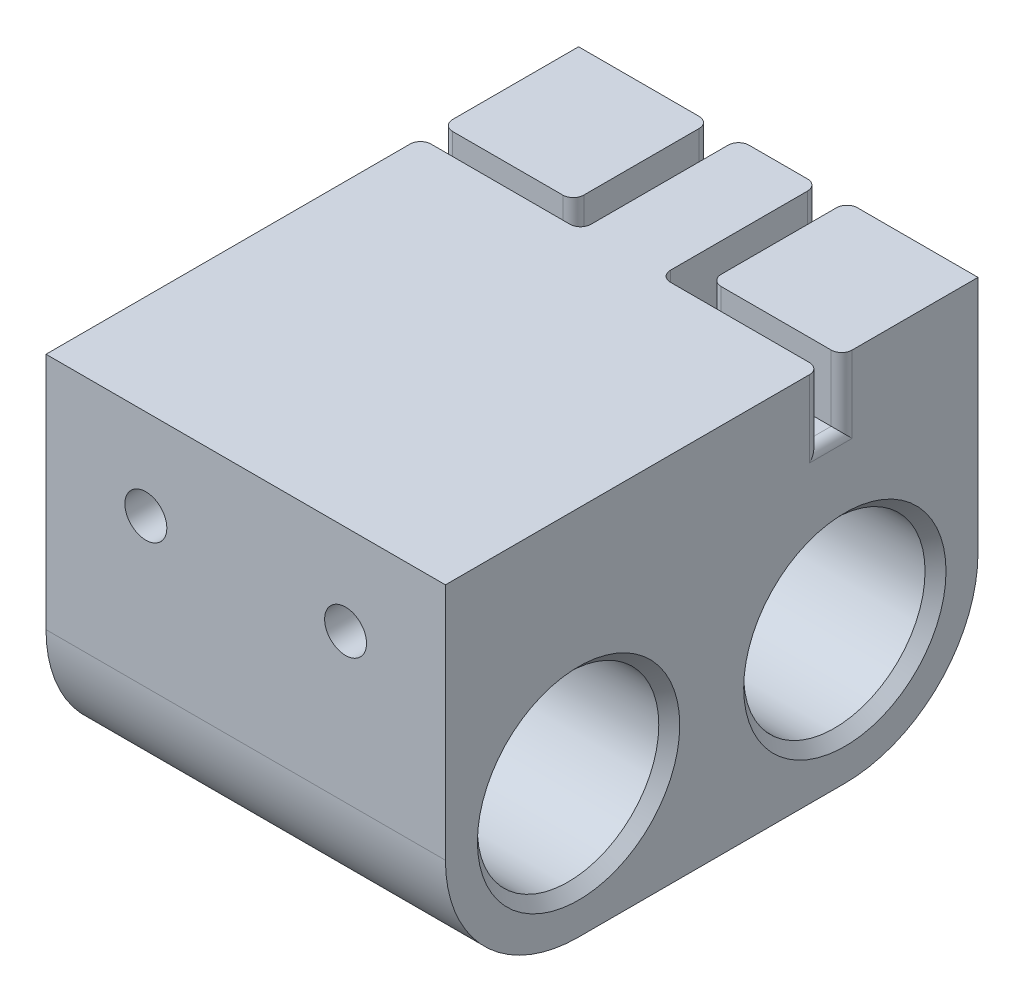
from build123d import *

# Parameters (mm, degrees)
SKETCH1_R           = 8.65
BOSS_EXTRUDE2_DEPTH = 38.1
CUT_EXTRUDE5_REACH  = 74.725
SKETCH6_R           = 2
BOSS_EXTRUDE3_REACH = 74.725
SKETCH10_R          = 2
CUT_EXTRUDE6_DEPTH  = 8
CHAMFER1_SIZE       = 1
CUT_EXTRUDE9_DEPTH  = 6.3
FILLET3_R           = 1


with BuildPart() as part:
    # Sketch1 → Boss-Extrude2 (new body)
    with BuildSketch(Plane(origin=(0, 0, 0), x_dir=(0, 0, -1), z_dir=(1, 0, 0))):
        with BuildLine():
            Line((50.8, 22.75), (0, 22.75))
            Line((0, 22.75), (0, 0))
            ThreePointArc((0, 0), (12.7, -12.7), (25.4, 0))
            ThreePointArc((25.4, 0), (38.1, -12.7), (50.8, 0))
            Line((50.8, 0), (50.8, 22.75))
        make_face()
        with Locations((38.1, 0)):
            Circle(SKETCH1_R, mode=Mode.SUBTRACT)
        with Locations((12.7, 0)):
            Circle(SKETCH1_R, mode=Mode.SUBTRACT)
    extrude(amount=BOSS_EXTRUDE2_DEPTH)

    # Sketch6 → Cut-Extrude5 (cut, up to next)
    with BuildSketch(Plane(origin=(0, -12.7, 0), x_dir=(-1, 0, 0), z_dir=(0, -1, 0)), mode=Mode.PRIVATE) as cut_extrude5_sk1:
        with Locations((-19.05, 38.1)):
            Circle(SKETCH6_R)
    cut_extrude5_tool1 = extrude(cut_extrude5_sk1.sketch, amount=-CUT_EXTRUDE5_REACH, mode=Mode.PRIVATE) & part.part
    # Sketch6 → Cut-Extrude5 (cut, up to next)
    with BuildSketch(Plane(origin=(0, -12.7, 0), x_dir=(-1, 0, 0), z_dir=(0, -1, 0)), mode=Mode.PRIVATE) as cut_extrude5_sk2:
        with Locations((-19.05, 12.7)):
            Circle(SKETCH6_R)
    cut_extrude5_tool2 = extrude(cut_extrude5_sk2.sketch, amount=-CUT_EXTRUDE5_REACH, mode=Mode.PRIVATE) & part.part
    add(cut_extrude5_tool1.solids().sort_by_distance((19.05, -12.7, -38.1))[0], mode=Mode.SUBTRACT)
    add(cut_extrude5_tool2.solids().sort_by_distance((19.05, -12.7, -12.7))[0], mode=Mode.SUBTRACT)

    # Sketch6<3> → Boss-Extrude3 (add, up to next)
    with BuildSketch(Plane(origin=(0, -12.7, 0), x_dir=(-1, 0, 0), z_dir=(0, -1, 0)), mode=Mode.PRIVATE) as boss_extrude3_sk1:
        with BuildLine():
            Line((0, 38.1), (-17.05, 38.1))
            ThreePointArc((-17.05, 38.1), (-19.05, 36.1), (-21.05, 38.1))
            Line((-21.05, 38.1), (-38.1, 38.1))
            Line((-38.1, 38.1), (-38.1, 12.7))
            Line((-38.1, 12.7), (-21.05, 12.7))
            ThreePointArc((-21.05, 12.7), (-19.05, 14.7), (-17.05, 12.7))
            Line((-17.05, 12.7), (0, 12.7))
            Line((0, 12.7), (0, 38.1))
        make_face()
    boss_extrude3_tool1 = extrude(boss_extrude3_sk1.sketch, amount=-BOSS_EXTRUDE3_REACH, mode=Mode.PRIVATE) - part.part
    add(boss_extrude3_tool1.solids().sort_by_distance((19.05, -12.7, -25.4))[0])

    # Sketch10 → Cut-Extrude6 (cut)
    with BuildSketch(Plane.XY):
        with Locations((9.525, 14.153125)):
            Circle(SKETCH10_R)
        with Locations((28.575, 14.153125)):
            Circle(SKETCH10_R)
    extrude(amount=-CUT_EXTRUDE6_DEPTH, mode=Mode.SUBTRACT)

    # Chamfer1
    chamfer1_edges = [part.edges().sort_by_distance(p)[0] for p in [
        (38.1, 0, -4.05),
        (38.1, 0, -29.45),
        (0, 0, -4.05),
        (0, 0, -29.45),
    ]]
    chamfer(chamfer1_edges, length=CHAMFER1_SIZE)

    # Sketch15 → Cut-Extrude9 (cut)
    with BuildSketch(Plane(origin=(0, 22.75, 0), x_dir=(1, 0, 0), z_dir=(0, 1, 0))):
        Polygon((12.5, 37.795), (0, 37.795), (0, 35.725), (15.26, 35.725), (15.26, 50.8), (12.5, 50.8), align=None)
        Polygon((25.6, 50.8), (22.84, 50.8), (22.84, 35.725), (38.1, 35.725), (38.1, 37.795), (25.6, 37.795), align=None)
    extrude(amount=-CUT_EXTRUDE9_DEPTH, mode=Mode.SUBTRACT)

    # Fillet3
    fillet3_edges = [part.edges().sort_by_distance(p)[0] for p in [
        (25.6, 19.6, -37.795),
        (22.84, 19.6, -35.725),
        (15.26, 19.6, -35.725),
        (12.5, 19.6, -37.795),
        (38.1, 19.6, -35.725),
        (38.1, 16.45, -36.76),
        (38.1, 19.6, -37.795),
        (25.6, 19.6, -50.8),
        (24.22, 16.45, -50.8),
        (22.84, 19.6, -50.8),
        (15.26, 19.6, -50.8),
        (13.88, 16.45, -50.8),
        (12.5, 19.6, -50.8),
        (0, 19.6, -37.795),
        (0, 16.45, -36.76),
        (0, 19.6, -35.725),
    ]]
    fillet(fillet3_edges, radius=FILLET3_R)


solid = part.part
